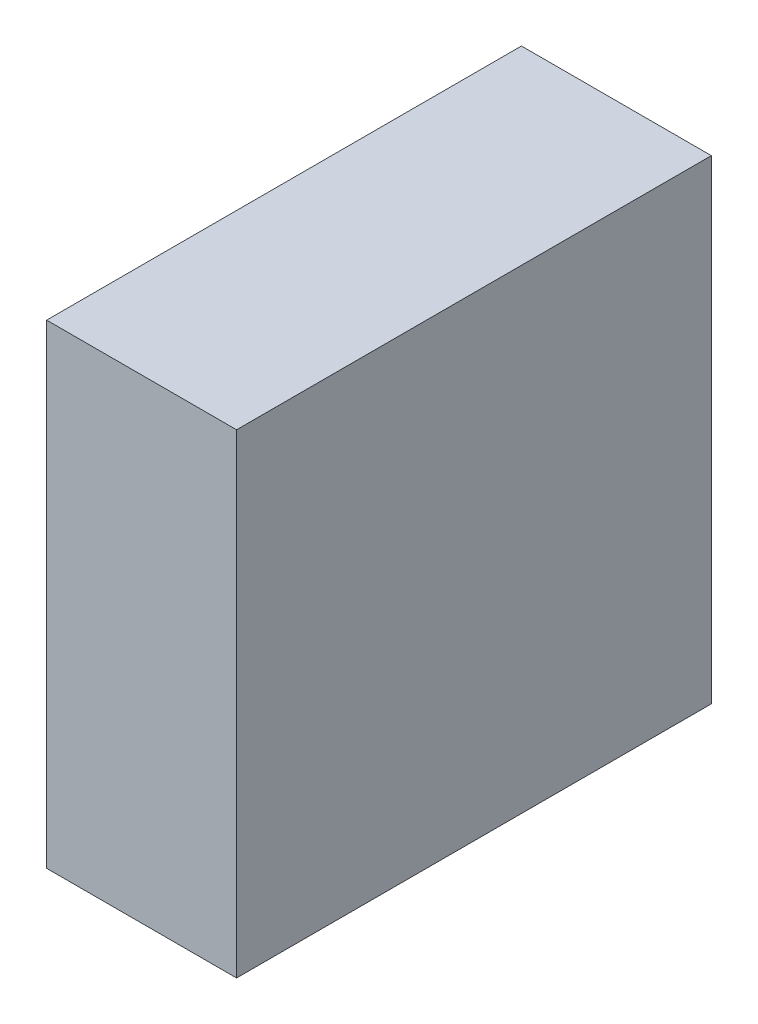
from build123d import *

# Parameters (mm, degrees)
SKETCH1_W           = 25.4
SKETCH1_H           = 63.5
BOSS_EXTRUDE1_DEPTH = 63.5


with BuildPart() as part:
    # Sketch1 → Boss-Extrude1 (new body)
    with BuildSketch(Plane.XY):
        Rectangle(SKETCH1_W, SKETCH1_H)
    extrude(amount=BOSS_EXTRUDE1_DEPTH)


solid = part.part
